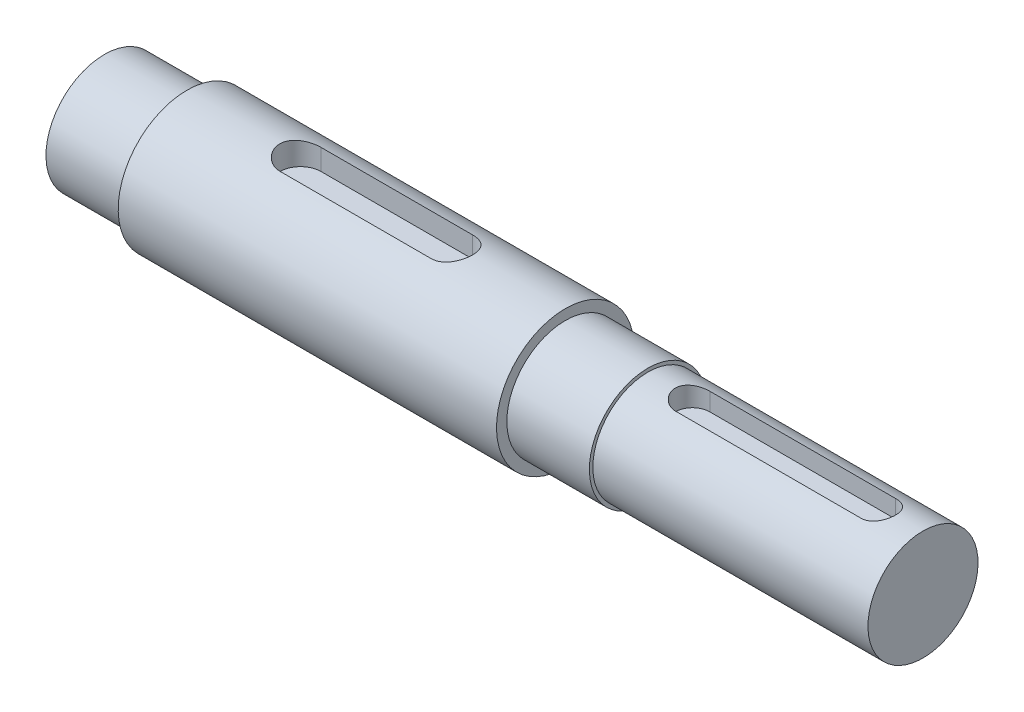
from build123d import *

# Parameters (mm, degrees)
CUT_EXTRUDE_START   = 6.5
CUT_EXTRUDE_1_DEPTH = 114.337389825
CUT_EXTRUDE_START_2 = 5
CUT_EXTRUDE_2_DEPTH = 115.837389841


with BuildPart() as part:
    # Эскиз1 → Повернуть1 (revolve)
    with BuildSketch(Plane.XY):
        Polygon((0, 0), (0, 8.5), (12, 8.5), (12, 10), (67, 10), (67, 8.5), (79, 8.5), (79, 8), (119, 8), (119, 0), align=None)
    revolve(axis=Axis((119, 0, 0), (-1, 0, 0)))

    # Эскиз2 → Вырез-Вытянуть1 (cut, through all)
    with BuildSketch(Plane(origin=(0, 0, 0), x_dir=(1, 0, 0), z_dir=(0, 1, 0)).offset(CUT_EXTRUDE_START)):
        with BuildLine():
            Line((28.5, 3), (50.5, 3))
            ThreePointArc((50.5, 3), (53.5, 0), (50.5, -3))
            Line((50.5, -3), (28.5, -3))
            ThreePointArc((28.5, -3), (25.5, 0), (28.5, 3))
        make_face()
    extrude(amount=CUT_EXTRUDE_1_DEPTH, mode=Mode.SUBTRACT)

    # Эскиз3 → Вырез-Вытянуть2 (cut, through all)
    with BuildSketch(Plane(origin=(0, 0, 0), x_dir=(1, 0, 0), z_dir=(0, 1, 0)).offset(CUT_EXTRUDE_START_2)):
        with BuildLine():
            Line((85.5, 2.5), (112.5, 2.5))
            ThreePointArc((112.5, 2.5), (115, 0), (112.5, -2.5))
            Line((112.5, -2.5), (85.5, -2.5))
            ThreePointArc((85.5, -2.5), (83, 0), (85.5, 2.5))
        make_face()
    extrude(amount=CUT_EXTRUDE_2_DEPTH, mode=Mode.SUBTRACT)


solid = part.part
